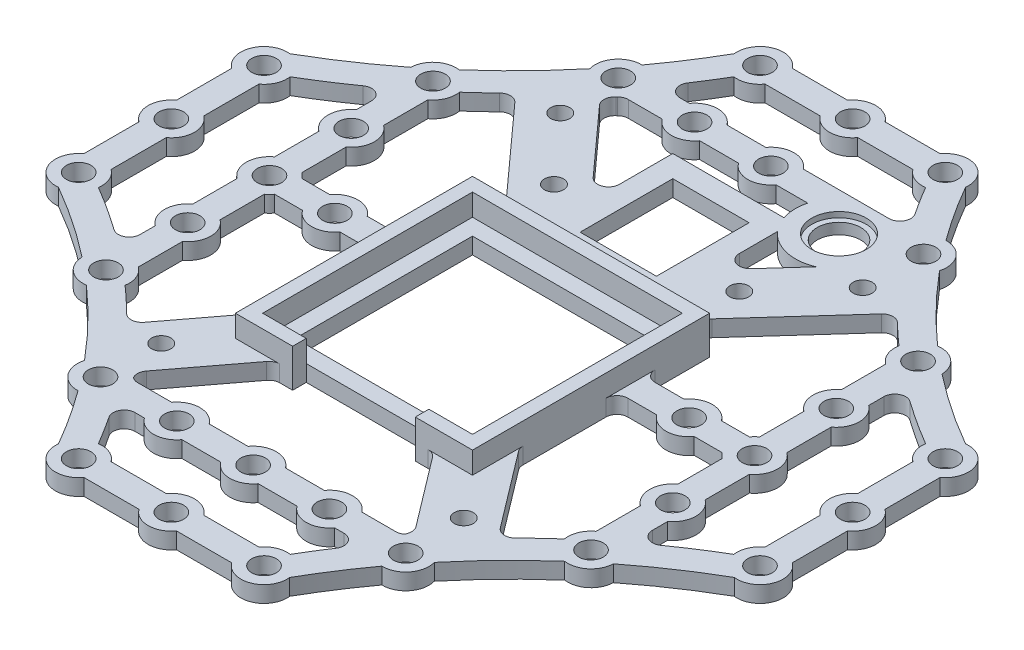
from build123d import *

# Parameters (mm, degrees)
SKETCH1_W                 = 64
SKETCH1_H                 = 82
SKETCH1_R                 = 1.75
BOSS_EXTRUDE1_DEPTH       = 3
GPS_HOUSING_DEPTH         = 4
SKETCH3_R                 = 1.75
SPECTRUM_COVER_HOLE_DEPTH = 53.163205423
SKETCH6_W                 = 64
SKETCH6_H                 = 82
EXTENSION_DEPTH           = 3
SKETCH7_W                 = 32.5
SKETCH7_H                 = 32.5
SKETCH7_W_2               = 14
SKETCH7_H_2               = 17
WEIGHT_REDUCER_DEPTH      = 93.010868923
SKETCH8_R                 = 4
ARM_BUTTON_HOLE_DEPTH     = 93.010868923
SKETCH9_R                 = 5
ARM_BUTTON_HOLE_LG_DEPTH  = 1
WEIGHT_REDUCER2_DEPTH     = 93.010868923
SKETCH12_R                = 2.25
MARKER_HOLES_DEPTH        = 93.010868923
SKETCH13_R                = 4.25
SKETCH13_R_2              = 2.25
BOSS_EXTRUDE3_DEPTH       = 3
FILLET1_R                 = 2


with BuildPart() as part:
    # Sketch1 → Boss-Extrude1 (new body)
    with BuildSketch(Plane(origin=(0, 0, 0), x_dir=(1, 0, 0), z_dir=(0, 1, 0))):
        Rectangle(SKETCH1_W, SKETCH1_H)
        with Locations(Location((27.75, -36.6, 0), (0, 0, 270))):
            Circle(SKETCH1_R, mode=Mode.SUBTRACT)
        with Locations(Location((-27.75, -36.6, 0), (0, 0, 90))):
            Circle(SKETCH1_R, mode=Mode.SUBTRACT)
        with Locations(Location((27.75, 36.6, 0), (0, 0, 90))):
            Circle(SKETCH1_R, mode=Mode.SUBTRACT)
        with Locations(Location((-27.75, 36.6, 0), (0, 0, 270))):
            Circle(SKETCH1_R, mode=Mode.SUBTRACT)
    extrude(amount=BOSS_EXTRUDE1_DEPTH)

    # Sketch2 → GPS-Housing (add)
    with BuildSketch(Plane(origin=(0, 3, 0), x_dir=(1, 0, 0), z_dir=(0, 1, 0))):
        Polygon((-11.25, -26.5), (-11.25, -29), (-21.75, -29), (-21.75, 14.5), (21.75, 14.5), (21.75, -29), (11.25, -29), (11.25, -26.5), (19.25, -26.5), (19.25, 12), (-19.25, 12), (-19.25, -26.5), align=None)
    extrude(amount=GPS_HOUSING_DEPTH)

    # Sketch3 → Spectrum-Cover-Hole (cut, through all)
    with BuildSketch(Plane(origin=(0, 3, 0), x_dir=(1, 0, 0), z_dir=(0, 1, 0))):
        with Locations(Location((-17, 24.7, 0), (0, 0, 270))):
            Circle(SKETCH3_R)
        with Locations(Location((17, 24.7, 0), (0, 0, 90))):
            Circle(SKETCH3_R)
    extrude(amount=-SPECTRUM_COVER_HOLE_DEPTH, mode=Mode.SUBTRACT)

    # Sketch6 → Extension (add)
    with BuildSketch(Plane(origin=(0, 3, 0), x_dir=(1, 0, 0), z_dir=(0, 1, 0))):
        with BuildLine():
            Line((65, 19.564738389), (65, -19.564738389))
            ThreePointArc((65, -19.564738389), (38.890872965, -38.890872965), (19.564738389, -65))
            Line((19.564738389, -65), (-19.564738389, -65))
            ThreePointArc((-19.564738389, -65), (-38.890872965, -38.890872965), (-65, -19.564738389))
            Line((-65, -19.564738389), (-65, 19.564738389))
            ThreePointArc((-65, 19.564738389), (-38.890872965, 38.890872965), (-19.564738389, 65))
            Line((-19.564738389, 65), (19.564738389, 65))
            ThreePointArc((19.564738389, 65), (38.890872965, 38.890872965), (65, 19.564738389))
        make_face()
        Rectangle(SKETCH6_W, SKETCH6_H, mode=Mode.SUBTRACT)
    extrude(amount=-EXTENSION_DEPTH)

    # Sketch7 → Weight-Reducer (cut, through all)
    with BuildSketch(Plane(origin=(0, 3, 0), x_dir=(1, 0, 0), z_dir=(0, 1, 0))):
        with BuildLine():
            Line((-16.606569371, -60), (16.606569371, -60))
            ThreePointArc((16.606569371, -60), (19.660466807, -54.917923956), (22.972235281, -50))
            Line((22.972235281, -50), (-22.972235281, -50))
            ThreePointArc((-22.972235281, -50), (-19.660466807, -54.917923956), (-16.606569371, -60))
        make_face()
        Polygon((-26.739111788, -45), (26.739111788, -45), (14.607964247, -29), (11.25, -29), (11.25, -26.5), (-11.25, -26.5), (-11.25, -29), (-14.607964247, -29), align=None)
        with BuildLine():
            Line((21.75, -20.410697831), (34.070657013, -36.66064546))
            ThreePointArc((34.070657013, -36.66064546), (37.947233166, -32.843544932), (42, -29.214057352))
            Line((42, -29.214057352), (42, -2.5))
            Line((42, -2.5), (21.75, -2.5))
            Line((21.75, -2.5), (21.75, -20.410697831))
        make_face()
        with BuildLine():
            ThreePointArc((-42, -29.214057352), (-37.947233166, -32.843544932), (-34.070657013, -36.66064546))
            Line((-34.070657013, -36.66064546), (-21.75, -20.410697831))
            Line((-21.75, -20.410697831), (-21.75, -2.5))
            Line((-21.75, -2.5), (-42, -2.5))
            Line((-42, -2.5), (-42, -29.214057352))
        make_face()
        with BuildLine():
            Line((47, 25.180946181), (47, -25.180946181))
            ThreePointArc((47, -25.180946181), (53.35469282, -20.673450996), (60, -16.606569371))
            Line((60, -16.606569371), (60, 16.606569371))
            ThreePointArc((60, 16.606569371), (53.35469282, 20.673450996), (47, 25.180946181))
        make_face()
        with BuildLine():
            ThreePointArc((-60, -16.606569371), (-53.35469282, -20.673450996), (-47, -25.180946181))
            Line((-47, -25.180946181), (-47, 25.180946181))
            ThreePointArc((-47, 25.180946181), (-53.35469282, 20.673450996), (-60, 16.606569371))
            Line((-60, 16.606569371), (-60, -16.606569371))
        make_face()
        with Locations((0, -7.25)):
            Rectangle(SKETCH7_W, SKETCH7_H)
        with BuildLine():
            Line((21.75, 14.5), (21.75, 2.5))
            Line((21.75, 2.5), (42, 2.5))
            Line((42, 2.5), (42, 29.214057352))
            ThreePointArc((42, 29.214057352), (38.441688909, 32.38192194), (35.017638916, 35.694447488))
            Line((35.017638916, 35.694447488), (15.871394336, 14.5))
            Line((15.871394336, 14.5), (21.75, 14.5))
        make_face()
        with BuildLine():
            Line((-42, 2.5), (-21.75, 2.5))
            Line((-21.75, 2.5), (-21.75, 14.5))
            Line((-21.75, 14.5), (-15.871394336, 14.5))
            Line((-15.871394336, 14.5), (-35.017638916, 35.694447488))
            ThreePointArc((-35.017638916, 35.694447488), (-38.441688909, 32.38192194), (-42, 29.214057352))
            Line((-42, 29.214057352), (-42, 2.5))
        make_face()
        with BuildLine():
            Line((-22.972235281, 50), (22.972235281, 50))
            ThreePointArc((22.972235281, 50), (19.660466807, 54.917923956), (16.606569371, 60))
            Line((16.606569371, 60), (-16.606569371, 60))
            ThreePointArc((-16.606569371, 60), (-19.660466807, 54.917923956), (-22.972235281, 50))
        make_face()
        with Locations((0, 28)):
            Rectangle(SKETCH7_W_2, SKETCH7_H_2)
    extrude(amount=-WEIGHT_REDUCER_DEPTH, mode=Mode.SUBTRACT)

    # Sketch8 → Arm-Button-Hole (cut, through all)
    with BuildSketch(Plane(origin=(0, 3, 0), x_dir=(1, 0, 0), z_dir=(0, 1, 0))):
        with Locations(Location((17, 43, 0), (0, 0, 270))):
            Circle(SKETCH8_R)
    extrude(amount=-ARM_BUTTON_HOLE_DEPTH, mode=Mode.SUBTRACT)

    # Sketch9 → Arm-Button-Hole-LG (cut)
    with BuildSketch(Plane(origin=(0, 3, 0), x_dir=(1, 0, 0), z_dir=(0, 1, 0))):
        with Locations(Location((17, 43, 0), (0, 0, 270))):
            Circle(SKETCH9_R)
    extrude(amount=-ARM_BUTTON_HOLE_LG_DEPTH, mode=Mode.SUBTRACT)

    # Sketch11 → Weight-Reducer2 (cut, through all)
    with BuildSketch(Plane(origin=(0, 3, 0), x_dir=(1, 0, 0), z_dir=(0, 1, 0))):
        with BuildLine():
            Line((-27.617180097, 43.911854604), (-11, 25.517022682))
            Line((-11, 25.517022682), (-11, 40.5))
            Line((-11, 40.5), (9.400657923, 40.5))
            ThreePointArc((9.400657923, 40.5), (9.004243294, 42.739472277), (9.254033308, 45))
            Line((9.254033308, 45), (-26.739111788, 45))
            ThreePointArc((-26.739111788, 45), (-27.17649214, 44.454592782), (-27.617180097, 43.911854604))
        make_face()
        with BuildLine():
            Line((11, 37.708497378), (11, 25.517022682))
            Line((11, 25.517022682), (20.150588827, 35.646511709))
            ThreePointArc((20.150588827, 35.646511709), (15.241383432, 35.195689155), (11, 37.708497378))
        make_face()
    extrude(amount=-WEIGHT_REDUCER2_DEPTH, mode=Mode.SUBTRACT)

    # Sketch12 → Marker-Holes (cut, through all)
    with BuildSketch(Plane(origin=(0, 3, 0), x_dir=(1, 0, 0), z_dir=(0, 1, 0))):
        with Locations(Location((62.5, 0, 0), (0, 0, 270))):
            Circle(SKETCH12_R)
        with Locations(Location((62.5, 17, 0), (0, 0, 270))):
            Circle(SKETCH12_R)
        with Locations(Location((62.5, -17, 0), (0, 0, 90))):
            Circle(SKETCH12_R)
        with Locations(Location((44.5, 30, 0), (0, 0, 270))):
            Circle(SKETCH12_R)
        with Locations(Location((44.5, 15, 0), (0, 0, 270))):
            Circle(SKETCH12_R)
        with Locations(Location((44.5, 0, 0), (0, 0, 270))):
            Circle(SKETCH12_R)
        with Locations(Location((44.5, -15, 0), (0, 0, 90))):
            Circle(SKETCH12_R)
        with Locations(Location((44.5, -30, 0), (0, 0, 90))):
            Circle(SKETCH12_R)
        with Locations(Location((32.5, 0, 0), (0, 0, 270))):
            Circle(SKETCH12_R)
        with Locations(Location((0, -47.5, 0), (0, 0, 270))):
            Circle(SKETCH12_R)
        with Locations(Location((-14, -47.5, 0), (0, 0, 270))):
            Circle(SKETCH12_R)
        with Locations(Location((-28, -47.5, 0), (0, 0, 270))):
            Circle(SKETCH12_R)
        with Locations(Location((14, -47.5, 0), (0, 0, 90))):
            Circle(SKETCH12_R)
        with Locations(Location((28, -47.5, 0), (0, 0, 90))):
            Circle(SKETCH12_R)
        with Locations(Location((28, 47.5, 0), (0, 0, 270))):
            Circle(SKETCH12_R)
        with Locations(Location((-17, -62.5, 0), (0, 0, 90))):
            Circle(SKETCH12_R)
        with Locations(Location((0, -62.5, 0), (0, 0, 270))):
            Circle(SKETCH12_R)
        with Locations(Location((17, -62.5, 0), (0, 0, 270))):
            Circle(SKETCH12_R)
        with Locations(Location((-32.5, 0, 0), (0, 0, 270))):
            Circle(SKETCH12_R)
        with Locations(Location((-44.5, 0, 0), (0, 0, 270))):
            Circle(SKETCH12_R)
        with Locations(Location((-44.5, -15, 0), (0, 0, 270))):
            Circle(SKETCH12_R)
        with Locations(Location((-44.5, -30, 0), (0, 0, 270))):
            Circle(SKETCH12_R)
        with Locations(Location((-44.5, 15, 0), (0, 0, 90))):
            Circle(SKETCH12_R)
        with Locations(Location((-44.5, 30, 0), (0, 0, 90))):
            Circle(SKETCH12_R)
        with Locations(Location((-62.5, 17, 0), (0, 0, 90))):
            Circle(SKETCH12_R)
        with Locations(Location((-62.5, 0, 0), (0, 0, 270))):
            Circle(SKETCH12_R)
        with Locations(Location((-62.5, -17, 0), (0, 0, 270))):
            Circle(SKETCH12_R)
        with Locations(Location((0, 47.5, 0), (0, 0, 90))):
            Circle(SKETCH12_R)
        with Locations(Location((-14, 47.5, 0), (0, 0, 90))):
            Circle(SKETCH12_R)
        with Locations(Location((-28, 47.5, 0), (0, 0, 90))):
            Circle(SKETCH12_R)
        with Locations(Location((17, 62.5, 0), (0, 0, 90))):
            Circle(SKETCH12_R)
        with Locations(Location((0, 62.5, 0), (0, 0, 270))):
            Circle(SKETCH12_R)
        with Locations(Location((-17, 62.5, 0), (0, 0, 270))):
            Circle(SKETCH12_R)
    extrude(amount=-MARKER_HOLES_DEPTH, mode=Mode.SUBTRACT)

    # Sketch13 → Boss-Extrude3 (add)
    # profile 1 of 33: a face of its own
    with BuildSketch(Plane(origin=(0, 3, 0), x_dir=(1, 0, 0), z_dir=(0, 1, 0))):
        with Locations((62.5, 0)):
            Circle(SKETCH13_R)
        with Locations(Location((62.5, 0, 0), (0, 0, 270))):
            Circle(SKETCH13_R_2, mode=Mode.SUBTRACT)
    # profile 2 of 33: a face of its own
    with BuildSketch(Plane(origin=(0, 3, 0), x_dir=(1, 0, 0), z_dir=(0, 1, 0))):
        with Locations((62.5, 17)):
            Circle(SKETCH13_R)
        with Locations(Location((62.5, 17, 0), (0, 0, 270))):
            Circle(SKETCH13_R_2, mode=Mode.SUBTRACT)
    # profile 3 of 33: a face of its own
    with BuildSketch(Plane(origin=(0, 3, 0), x_dir=(1, 0, 0), z_dir=(0, 1, 0))):
        with Locations((62.5, -17)):
            Circle(SKETCH13_R)
        with Locations(Location((62.5, -17, 0), (0, 0, 90))):
            Circle(SKETCH13_R_2, mode=Mode.SUBTRACT)
    # profile 4 of 33: a face of its own
    with BuildSketch(Plane(origin=(0, 3, 0), x_dir=(1, 0, 0), z_dir=(0, 1, 0))):
        with Locations((44.5, 30)):
            Circle(SKETCH13_R)
        with Locations(Location((44.5, 30, 0), (0, 0, 270))):
            Circle(SKETCH13_R_2, mode=Mode.SUBTRACT)
    # profile 5 of 33: a face of its own
    with BuildSketch(Plane(origin=(0, 3, 0), x_dir=(1, 0, 0), z_dir=(0, 1, 0))):
        with Locations((44.5, 15)):
            Circle(SKETCH13_R)
        with Locations(Location((44.5, 15, 0), (0, 0, 270))):
            Circle(SKETCH13_R_2, mode=Mode.SUBTRACT)
    # profile 6 of 33: a face of its own
    with BuildSketch(Plane(origin=(0, 3, 0), x_dir=(1, 0, 0), z_dir=(0, 1, 0))):
        with Locations((44.5, 0)):
            Circle(SKETCH13_R)
        with Locations(Location((44.5, 0, 0), (0, 0, 270))):
            Circle(SKETCH13_R_2, mode=Mode.SUBTRACT)
    # profile 7 of 33: a face of its own
    with BuildSketch(Plane(origin=(0, 3, 0), x_dir=(1, 0, 0), z_dir=(0, 1, 0))):
        with Locations((44.5, -15)):
            Circle(SKETCH13_R)
        with Locations(Location((44.5, -15, 0), (0, 0, 90))):
            Circle(SKETCH13_R_2, mode=Mode.SUBTRACT)
    # profile 8 of 33: a face of its own
    with BuildSketch(Plane(origin=(0, 3, 0), x_dir=(1, 0, 0), z_dir=(0, 1, 0))):
        with Locations((44.5, -30)):
            Circle(SKETCH13_R)
        with Locations(Location((44.5, -30, 0), (0, 0, 90))):
            Circle(SKETCH13_R_2, mode=Mode.SUBTRACT)
    # profile 9 of 33: a face of its own
    with BuildSketch(Plane(origin=(0, 3, 0), x_dir=(1, 0, 0), z_dir=(0, 1, 0))):
        with Locations((32.5, 0)):
            Circle(SKETCH13_R)
        with Locations(Location((32.5, 0, 0), (0, 0, 270))):
            Circle(SKETCH13_R_2, mode=Mode.SUBTRACT)
    # profile 10 of 33: a face of its own
    with BuildSketch(Plane(origin=(0, 3, 0), x_dir=(1, 0, 0), z_dir=(0, 1, 0))):
        with Locations((17, -62.5)):
            Circle(SKETCH13_R)
        with Locations(Location((17, -62.5, 0), (0, 0, 270))):
            Circle(SKETCH13_R_2, mode=Mode.SUBTRACT)
    # profile 11 of 33: a face of its own
    with BuildSketch(Plane(origin=(0, 3, 0), x_dir=(1, 0, 0), z_dir=(0, 1, 0))):
        with Locations((0, -62.5)):
            Circle(SKETCH13_R)
        with Locations(Location((0, -62.5, 0), (0, 0, 270))):
            Circle(SKETCH13_R_2, mode=Mode.SUBTRACT)
    # profile 12 of 33: a face of its own
    with BuildSketch(Plane(origin=(0, 3, 0), x_dir=(1, 0, 0), z_dir=(0, 1, 0))):
        with Locations((-17, -62.5)):
            Circle(SKETCH13_R)
        with Locations(Location((-17, -62.5, 0), (0, 0, 90))):
            Circle(SKETCH13_R_2, mode=Mode.SUBTRACT)
    # profile 13 of 33: a face of its own
    with BuildSketch(Plane(origin=(0, 3, 0), x_dir=(1, 0, 0), z_dir=(0, 1, 0))):
        with Locations((-62.5, -17)):
            Circle(SKETCH13_R)
        with Locations(Location((-62.5, -17, 0), (0, 0, 270))):
            Circle(SKETCH13_R_2, mode=Mode.SUBTRACT)
    # profile 14 of 33: a face of its own
    with BuildSketch(Plane(origin=(0, 3, 0), x_dir=(1, 0, 0), z_dir=(0, 1, 0))):
        with Locations((-62.5, 0)):
            Circle(SKETCH13_R)
        with Locations(Location((-62.5, 0, 0), (0, 0, 270))):
            Circle(SKETCH13_R_2, mode=Mode.SUBTRACT)
    # profile 15 of 33: a face of its own
    with BuildSketch(Plane(origin=(0, 3, 0), x_dir=(1, 0, 0), z_dir=(0, 1, 0))):
        with Locations((-62.5, 17)):
            Circle(SKETCH13_R)
        with Locations(Location((-62.5, 17, 0), (0, 0, 90))):
            Circle(SKETCH13_R_2, mode=Mode.SUBTRACT)
    # profile 16 of 33: a face of its own
    with BuildSketch(Plane(origin=(0, 3, 0), x_dir=(1, 0, 0), z_dir=(0, 1, 0))):
        with Locations((-17, 62.5)):
            Circle(SKETCH13_R)
        with Locations(Location((-17, 62.5, 0), (0, 0, 270))):
            Circle(SKETCH13_R_2, mode=Mode.SUBTRACT)
    # profile 17 of 33: a face of its own
    with BuildSketch(Plane(origin=(0, 3, 0), x_dir=(1, 0, 0), z_dir=(0, 1, 0))):
        with Locations((0, 62.5)):
            Circle(SKETCH13_R)
        with Locations(Location((0, 62.5, 0), (0, 0, 270))):
            Circle(SKETCH13_R_2, mode=Mode.SUBTRACT)
    # profile 18 of 33: a face of its own
    with BuildSketch(Plane(origin=(0, 3, 0), x_dir=(1, 0, 0), z_dir=(0, 1, 0))):
        with Locations((17, 62.5)):
            Circle(SKETCH13_R)
        with Locations(Location((17, 62.5, 0), (0, 0, 90))):
            Circle(SKETCH13_R_2, mode=Mode.SUBTRACT)
    # profile 19 of 33: a face of its own
    with BuildSketch(Plane(origin=(0, 3, 0), x_dir=(1, 0, 0), z_dir=(0, 1, 0))):
        with Locations((-32.5, 0)):
            Circle(SKETCH13_R)
        with Locations(Location((-32.5, 0, 0), (0, 0, 270))):
            Circle(SKETCH13_R_2, mode=Mode.SUBTRACT)
    # profile 20 of 33: a face of its own
    with BuildSketch(Plane(origin=(0, 3, 0), x_dir=(1, 0, 0), z_dir=(0, 1, 0))):
        with Locations((-44.5, -30)):
            Circle(SKETCH13_R)
        with Locations(Location((-44.5, -30, 0), (0, 0, 270))):
            Circle(SKETCH13_R_2, mode=Mode.SUBTRACT)
    # profile 21 of 33: a face of its own
    with BuildSketch(Plane(origin=(0, 3, 0), x_dir=(1, 0, 0), z_dir=(0, 1, 0))):
        with Locations((-44.5, -15)):
            Circle(SKETCH13_R)
        with Locations(Location((-44.5, -15, 0), (0, 0, 270))):
            Circle(SKETCH13_R_2, mode=Mode.SUBTRACT)
    # profile 22 of 33: a face of its own
    with BuildSketch(Plane(origin=(0, 3, 0), x_dir=(1, 0, 0), z_dir=(0, 1, 0))):
        with Locations((-44.5, 0)):
            Circle(SKETCH13_R)
        with Locations(Location((-44.5, 0, 0), (0, 0, 270))):
            Circle(SKETCH13_R_2, mode=Mode.SUBTRACT)
    # profile 23 of 33: a face of its own
    with BuildSketch(Plane(origin=(0, 3, 0), x_dir=(1, 0, 0), z_dir=(0, 1, 0))):
        with Locations((-44.5, 15)):
            Circle(SKETCH13_R)
        with Locations(Location((-44.5, 15, 0), (0, 0, 90))):
            Circle(SKETCH13_R_2, mode=Mode.SUBTRACT)
    # profile 24 of 33: a face of its own
    with BuildSketch(Plane(origin=(0, 3, 0), x_dir=(1, 0, 0), z_dir=(0, 1, 0))):
        with Locations((-44.5, 30)):
            Circle(SKETCH13_R)
        with Locations(Location((-44.5, 30, 0), (0, 0, 90))):
            Circle(SKETCH13_R_2, mode=Mode.SUBTRACT)
    # profile 25 of 33: a face of its own
    with BuildSketch(Plane(origin=(0, 3, 0), x_dir=(1, 0, 0), z_dir=(0, 1, 0))):
        with Locations((-28, -47.5)):
            Circle(SKETCH13_R)
        with Locations(Location((-28, -47.5, 0), (0, 0, 270))):
            Circle(SKETCH13_R_2, mode=Mode.SUBTRACT)
    # profile 26 of 33: a face of its own
    with BuildSketch(Plane(origin=(0, 3, 0), x_dir=(1, 0, 0), z_dir=(0, 1, 0))):
        with Locations((-14, -47.5)):
            Circle(SKETCH13_R)
        with Locations(Location((-14, -47.5, 0), (0, 0, 270))):
            Circle(SKETCH13_R_2, mode=Mode.SUBTRACT)
    # profile 27 of 33: a face of its own
    with BuildSketch(Plane(origin=(0, 3, 0), x_dir=(1, 0, 0), z_dir=(0, 1, 0))):
        with Locations((0, -47.5)):
            Circle(SKETCH13_R)
        with Locations(Location((0, -47.5, 0), (0, 0, 270))):
            Circle(SKETCH13_R_2, mode=Mode.SUBTRACT)
    # profile 28 of 33: a face of its own
    with BuildSketch(Plane(origin=(0, 3, 0), x_dir=(1, 0, 0), z_dir=(0, 1, 0))):
        with Locations((14, -47.5)):
            Circle(SKETCH13_R)
        with Locations(Location((14, -47.5, 0), (0, 0, 90))):
            Circle(SKETCH13_R_2, mode=Mode.SUBTRACT)
    # profile 29 of 33: a face of its own
    with BuildSketch(Plane(origin=(0, 3, 0), x_dir=(1, 0, 0), z_dir=(0, 1, 0))):
        with Locations((28, -47.5)):
            Circle(SKETCH13_R)
        with Locations(Location((28, -47.5, 0), (0, 0, 90))):
            Circle(SKETCH13_R_2, mode=Mode.SUBTRACT)
    # profile 30 of 33: a face of its own
    with BuildSketch(Plane(origin=(0, 3, 0), x_dir=(1, 0, 0), z_dir=(0, 1, 0))):
        with Locations((28, 47.5)):
            Circle(SKETCH13_R)
        with Locations(Location((28, 47.5, 0), (0, 0, 270))):
            Circle(SKETCH13_R_2, mode=Mode.SUBTRACT)
    # profile 31 of 33: a face of its own
    with BuildSketch(Plane(origin=(0, 3, 0), x_dir=(1, 0, 0), z_dir=(0, 1, 0))):
        with Locations((0, 47.5)):
            Circle(SKETCH13_R)
        with Locations(Location((0, 47.5, 0), (0, 0, 90))):
            Circle(SKETCH13_R_2, mode=Mode.SUBTRACT)
    # profile 32 of 33: a face of its own
    with BuildSketch(Plane(origin=(0, 3, 0), x_dir=(1, 0, 0), z_dir=(0, 1, 0))):
        with Locations((-14, 47.5)):
            Circle(SKETCH13_R)
        with Locations(Location((-14, 47.5, 0), (0, 0, 90))):
            Circle(SKETCH13_R_2, mode=Mode.SUBTRACT)
    # profile 33 of 33: a face of its own
    with BuildSketch(Plane(origin=(0, 3, 0), x_dir=(1, 0, 0), z_dir=(0, 1, 0))):
        with Locations((-28, 47.5)):
            Circle(SKETCH13_R)
        with Locations(Location((-28, 47.5, 0), (0, 0, 90))):
            Circle(SKETCH13_R_2, mode=Mode.SUBTRACT)
    extrude(amount=-BOSS_EXTRUDE3_DEPTH)

    # Fillet1
    # the kernel refuses this fillet: 2 mm, written as the material it adds along each edge
    with BuildSketch(Plane(origin=(11, 3, -25.517022682), x_dir=(0.6703416451628493, 0, -0.7420526118546882), z_dir=(0, -1, 0)), Plane(origin=(-11, 3, -25.517022682), x_dir=(0, 0, -1), z_dir=(0, -1, 0))) as fillet1_piece_1:
        with BuildLine():
            CenterArc((FILLET1_R * 2.59875337363, -FILLET1_R), FILLET1_R, 90, 137.906561383)
            Line((FILLET1_R * 1.92841172847, -FILLET1_R * 1.74205261185), (0, 0))
            Line((0, 0), (FILLET1_R * 2.59875337363, 0))
        make_face()
    extrude(amount=3)
    with BuildSketch(Plane(origin=(-24.563068229, 0, -45), x_dir=(-0.6566276135781905, 0, 0.7542149409065101), z_dir=(0, 1, 0)), Plane(origin=(24.563068229, 0, 45), x_dir=(0.6566276135781925, 0, -0.7542149409065083), z_dir=(0, 1, 0))) as fillet1_piece_2:
        with BuildLine():
            CenterArc((0.917198359, 1.992354977), FILLET1_R, 221.043179755, 43.945519562)
            Line((-0.591231523, 0.67909975), (0, 0))
            ThreePointArc((0, 0), (0.371246955, 0.016245673), (0.742493909, 0))
        make_face()
    extrude(amount=3)
    with BuildSketch(Plane(origin=(-27.105320431, 0, -43.345237857), x_dir=(0.6703416451628492, 0, 0.7420526118546884), z_dir=(0, 1, 0))) as fillet1_piece_3:
        with BuildLine():
            CenterArc((2.566031451, 2), FILLET1_R, 178.888751759, 91.111248241)
            ThreePointArc((0.566407603, 2.038787449), (0.412117765, 0.983579374), (0, 0))
            Line((0, 0), (2.566031451, 0))
        make_face()
    extrude(amount=3)
    with BuildSketch(Plane(origin=(25.853468079, 0, 43.831907756), x_dir=(-0.6041720261673023, 0, -0.7968539155936278), z_dir=(0, 1, 0))) as fillet1_piece_4:
        with BuildLine():
            CenterArc((1.848925329, 2), FILLET1_R, 193.832848453, 76.167151547)
            ThreePointArc((-0.093069403, 1.521819634), (0.022266227, 0.765117452), (0, 0))
            Line((0, 0), (1.848925329, 0))
        make_face()
    extrude(amount=3)
    with BuildSketch(Plane(origin=(-24.563068229, 0, 45), x_dir=(1, 0, 0), z_dir=(0, 1, 0))) as fillet1_piece_5:
        with BuildLine():
            CenterArc((0.900406122, 2), FILLET1_R, 226.054480438, 43.945519562)
            ThreePointArc((-0.487542004, 0.56), (-0.231518272, 0.290667358), (0, 0))
            Line((0, 0), (0.900406122, 0))
        make_face()
    extrude(amount=3)
    with BuildSketch(Plane(origin=(-25.853468079, 0, 43.831907756), x_dir=(0.7584876736392587, 0, 0.6516873858970308), z_dir=(0, 1, 0))) as fillet1_piece_6:
        with BuildLine():
            CenterArc((1.883407093, 1.967562602), FILLET1_R, 183.499659662, 76.167151547)
            Line((-0.112863229, 1.845477381), (0, 0))
            ThreePointArc((0, 0), (0.762331442, 0.068929471), (1.524662885, 0))
        make_face()
    extrude(amount=3)
    with BuildSketch(Plane(origin=(22.972235281, 3, 50), x_dir=(-1, 0, 0), z_dir=(0, -1, 0))) as fillet1_piece_7:
        with BuildLine():
            CenterArc((3.80065415, -2), FILLET1_R, 90, 123.55639038)
            ThreePointArc((2.133969743, -3.105514853), (1.079704935, -1.544016773), (0, 0))
            Line((0, 0), (3.80065415, 0))
        make_face()
    extrude(amount=3)
    with BuildSketch(Plane(origin=(-22.972235281, 3, 50), x_dir=(1, 0, 0), z_dir=(0, -1, 0))) as fillet1_piece_8:
        with BuildLine():
            CenterArc((3.80065415, 2), FILLET1_R, 146.44360962, 123.55639038)
            ThreePointArc((2.133969743, 3.105514853), (1.079704935, 1.544016773), (0, 0))
            Line((0, 0), (3.80065415, 0))
        make_face()
    extrude(amount=3)
    with BuildSketch(Plane(origin=(22.972235281, 3, -50), x_dir=(-0.5663356706350274, 0, -0.824174683041389), z_dir=(0, -1, 0))) as fillet1_piece_9:
        with BuildLine():
            CenterArc((3.800795383, -1.999731588), FILLET1_R, 90.938703779, 123.556390381)
            Line((2.152446017, -3.132402929), (0, 0))
            ThreePointArc((0, 0), (1.884014953, -0.015433698), (3.768029905, 0))
        make_face()
    extrude(amount=3)
    with BuildSketch(Plane(origin=(-22.972235281, 3, -50), x_dir=(0.566335670635032, 0, -0.8241746830413855), z_dir=(0, -1, 0))) as fillet1_piece_10:
        with BuildLine():
            CenterArc((3.800795383, 1.999731588), FILLET1_R, 145.50490584, 123.556390381)
            Line((2.152446017, 3.132402929), (0, 0))
            ThreePointArc((0, 0), (1.884014953, 0.015433698), (3.768029905, 0))
        make_face()
    extrude(amount=3)
    with BuildSketch(Plane(origin=(21.75, 3, 2.5), x_dir=(0, 0, 1), z_dir=(0, -1, 0)), Plane(origin=(21.75, 3, -2.5), x_dir=(1, 0, 0), z_dir=(0, -1, 0)), Plane(origin=(-21.75, 3, 2.5), x_dir=(-1, 0, 0), z_dir=(0, -1, 0)), Plane(origin=(-21.75, 3, -2.5), x_dir=(0, 0, -1), z_dir=(0, -1, 0))) as fillet1_piece_11:
        with BuildLine():
            CenterArc((FILLET1_R, -FILLET1_R), FILLET1_R, 90, 90)
            Line((0, -FILLET1_R), (0, 0))
            Line((0, 0), (FILLET1_R, 0))
        make_face()
    extrude(amount=3)
    with BuildSketch(Plane(origin=(47, 3, 25.180946181), x_dir=(0, 0, -1), z_dir=(0, -1, 0)), Plane(origin=(-47, 3, -25.180946181), x_dir=(0, 0, 1), z_dir=(0, -1, 0))) as fillet1_piece_12:
        with BuildLine():
            CenterArc((3.951591331, 2), FILLET1_R, 144.662023045, 125.337976955)
            ThreePointArc((2.320082544, 3.156796904), (1.173484957, 1.568518038), (0, 0))
            Line((0, 0), (3.951591331, 0))
        make_face()
    extrude(amount=3)
    with BuildSketch(Plane(origin=(-47, 3, 25.180946181), x_dir=(0, 0, -1), z_dir=(0, -1, 0)), Plane(origin=(47, 3, -25.180946181), x_dir=(0, 0, 1), z_dir=(0, -1, 0))) as fillet1_piece_13:
        with BuildLine():
            CenterArc((3.951591331, -2), FILLET1_R, 90, 125.337976955)
            ThreePointArc((2.320082544, -3.156796904), (1.173484957, -1.568518038), (0, 0))
            Line((0, 0), (3.951591331, 0))
        make_face()
    extrude(amount=3)
    with BuildSketch(Plane(origin=(-34.070657013, 3, 36.66064546), x_dir=(0.6041720261672991, 0, -0.7968539155936302), z_dir=(0, -1, 0))) as fillet1_piece_14:
        with BuildLine():
            CenterArc((2.307674639, -2), FILLET1_R, 90, 97.603311609)
            ThreePointArc((0.32525885, -2.264627362), (0.168261264, -1.131504804), (0, 0))
            Line((0, 0), (2.307674639, 0))
        make_face()
    extrude(amount=3)
    with BuildSketch(Plane(origin=(34.070657013, 3, 36.66064546), x_dir=(-0.6041720261673006, 0, -0.7968539155936292), z_dir=(0, -1, 0))) as fillet1_piece_15:
        with BuildLine():
            CenterArc((2.307674639, 2), FILLET1_R, 172.396688391, 97.603311609)
            ThreePointArc((0.32525885, 2.264627362), (0.168261264, 1.131504804), (0, 0))
            Line((0, 0), (2.307674639, 0))
        make_face()
    extrude(amount=3)
    with BuildSketch(Plane(origin=(-35.017638916, 3, -35.694447488), x_dir=(0.6703416451628513, 0, 0.7420526118546864), z_dir=(0, -1, 0))) as fillet1_piece_16:
        with BuildLine():
            CenterArc((2.093818421, 2), FILLET1_R, 177.889250224, 92.110749776)
            ThreePointArc((0.095175419, 2.073662402), (0.052266721, 1.036616447), (0, 0))
            Line((0, 0), (2.093818421, 0))
        make_face()
    extrude(amount=3)
    with BuildSketch(Plane(origin=(-21.75, 3, 20.410697831), x_dir=(-0.6041720261672752, 0, 0.7968539155936484), z_dir=(0, -1, 0))) as fillet1_piece_17:
        with BuildLine():
            CenterArc((FILLET1_R * 0.336238812139, FILLET1_R), FILLET1_R, 232.830714984, 37.169285016)
            Line((-FILLET1_R * 0.267933214028, FILLET1_R * 0.203146084406), (0, 0))
            Line((0, 0), (FILLET1_R * 0.336238812139, 0))
        make_face()
    extrude(amount=3)
    with BuildSketch(Plane(origin=(-14.607964247, 3, 29), x_dir=(1, 0, 0), z_dir=(0, -1, 0))) as fillet1_piece_18:
        with BuildLine():
            CenterArc((FILLET1_R * 0.49673844363, FILLET1_R), FILLET1_R, 217.169285016, 52.830714984)
            Line((-FILLET1_R * 0.300115471963, FILLET1_R * 0.395827973833), (0, 0))
            Line((0, 0), (FILLET1_R * 0.49673844363, 0))
        make_face()
    extrude(amount=3)
    with BuildSketch(Plane(origin=(14.607964247, 3, 29), x_dir=(-1, 0, 0), z_dir=(0, -1, 0))) as fillet1_piece_19:
        with BuildLine():
            CenterArc((FILLET1_R * 0.49673844363, -FILLET1_R), FILLET1_R, 90, 52.830714984)
            Line((-FILLET1_R * 0.300115471963, -FILLET1_R * 0.395827973833), (0, 0))
            Line((0, 0), (FILLET1_R * 0.49673844363, 0))
        make_face()
    extrude(amount=3)
    with BuildSketch(Plane(origin=(21.75, 3, 20.410697831), x_dir=(0.6041720261673004, 0, 0.7968539155936293), z_dir=(0, -1, 0))) as fillet1_piece_20:
        with BuildLine():
            CenterArc((FILLET1_R * 0.336238812139, -FILLET1_R), FILLET1_R, 90, 37.169285016)
            Line((-FILLET1_R * 0.267933214028, -FILLET1_R * 0.203146084406), (0, 0))
            Line((0, 0), (FILLET1_R * 0.336238812139, 0))
        make_face()
    extrude(amount=3)
    with BuildSketch(Plane(origin=(-15.871394336, 3, -14.5), x_dir=(-0.670341645162849, 0, -0.7420526118546885), z_dir=(0, -1, 0))) as fillet1_piece_21:
        with BuildLine():
            CenterArc((FILLET1_R * 2.25097468627, -FILLET1_R), FILLET1_R, 90, 132.093438617)
            Line((FILLET1_R * 1.50892207441, -FILLET1_R * 1.67034164516), (0, 0))
            Line((0, 0), (FILLET1_R * 2.25097468627, 0))
        make_face()
    extrude(amount=3)
    with BuildSketch(Plane(origin=(15.871394336, 3, -14.5), x_dir=(0.6703416451628493, 0, -0.7420526118546882), z_dir=(0, -1, 0))) as fillet1_piece_22:
        with BuildLine():
            CenterArc((FILLET1_R * 2.25097468627, FILLET1_R), FILLET1_R, 137.906561383, 132.093438617)
            Line((FILLET1_R * 1.50892207441, FILLET1_R * 1.67034164516), (0, 0))
            Line((0, 0), (FILLET1_R * 2.25097468627, 0))
        make_face()
    extrude(amount=3)
    with BuildSketch(Plane(origin=(35.017638916, 3, -35.694447488), x_dir=(-0.6703416451628462, 0, 0.742052611854691), z_dir=(0, -1, 0))) as fillet1_piece_23:
        with BuildLine():
            CenterArc((2.093818421, -2), FILLET1_R, 90, 92.110749776)
            ThreePointArc((0.095175419, -2.073662402), (0.052266721, -1.036616447), (0, 0))
            Line((0, 0), (2.093818421, 0))
        make_face()
    extrude(amount=3)


solid = part.part
